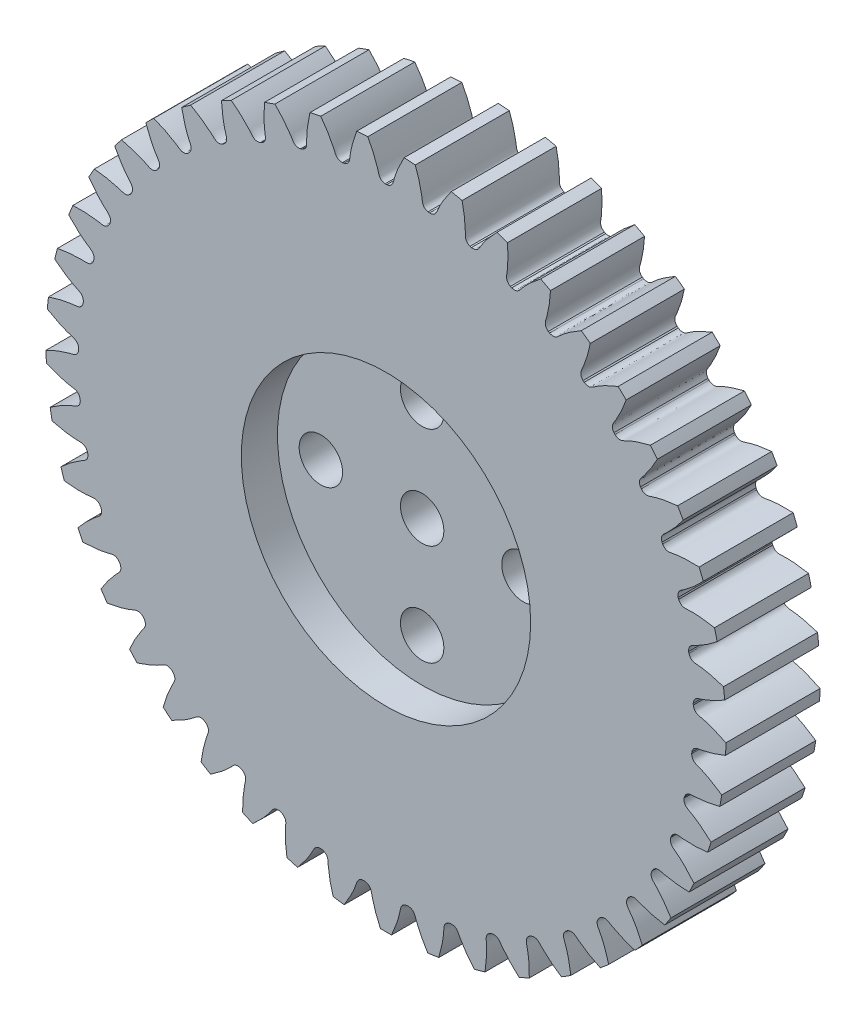
from build123d import *

# Parameters (mm, degrees)
SKETCH_1_R               = 23.5
EXTRUDE_1_DEPTH          = 6.5
CUT_EXTRUDE_1_DEPTH      = 34.863697376
PATTERN_CIRCULAR_1_COUNT = 45
SKETCH_4_R               = 1.5
CUT_EXTRUDE_2_DEPTH      = 10
SKETCH_5_R               = 1.5
CUT_EXTRUDE_3_DEPTH      = 10
SKETCH_6_R               = 10
CUT_EXTRUDE_4_DEPTH      = 2.5


with BuildPart() as part:
    # 草图1 → 凸台-拉伸1 (new body)
    with BuildSketch(Plane.XY):
        Circle(SKETCH_1_R)
    extrude(amount=EXTRUDE_1_DEPTH)

    # 草图2 → 切除-拉伸1 (cut, through all)
    with BuildSketch(Plane.XY):
        with BuildLine():
            ThreePointArc((0.051873264, 21.249936686), (0, 21.25), (-0.051873264, 21.249936686))
            add(Edge.make_bspline(
                [(-0.051873264, 21.249936686), (-0.443572136, 21.304099562), (-0.488057885, 21.594745963), (-0.580625684, 21.909595528), (-0.616187717, 22.023701477), (-0.656820366, 22.145031226), (-0.702678597, 22.273509106), (-0.754106978, 22.408946374), (-0.811388198, 22.551175843), (-0.874816981, 22.700012294), (-0.944678084, 22.855264244), (-1.021252408, 23.016730684), (-1.104814919, 23.184202197), (-1.195634949, 23.357460817), (-1.293975814, 23.536280256), (-1.400094629, 23.720426036), (-1.514242081, 23.909655655), (-1.636662209, 24.103718747), (-1.767592191, 24.302357255), (-1.907262137, 24.505305605), (-2.055894882, 24.712290888), (-2.213705786, 24.923033045), (-2.380902537, 25.137245056), (-2.557684962, 25.354633139), (-2.744244834, 25.574896952), (-2.940765714, 25.79772979), (-3.147422686, 26.022818809), (-3.44059804, 26.329597021), (-3.670417998, 26.555895846), (-3.828553255, 26.70565732)],
                knots=[0, 0, 0, 0, 0.112268392, 0.128789174, 0.146568276, 0.165605699, 0.185901442, 0.207455506, 0.23026789, 0.254338595, 0.27966762, 0.306254966, 0.334100632, 0.363204619, 0.393566926, 0.425187554, 0.458066503, 0.492203772, 0.527599361, 0.564253271, 0.602165502, 0.641336053, 0.681764924, 0.723452116, 0.766397629, 0.810601462, 0.856063616, 0.90278409, 1, 1, 1, 1], degree=3))
            ThreePointArc((-3.828553255, 26.70565732), (0, 26.978694426), (3.828553255, 26.70565732))
            add(Edge.make_bspline(
                [(0.051873264, 21.249936686), (0.443572136, 21.304099562), (0.488057885, 21.594745963), (0.580625684, 21.909595528), (0.616187717, 22.023701477), (0.656820366, 22.145031226), (0.702678597, 22.273509106), (0.754106978, 22.408946374), (0.811388198, 22.551175843), (0.874816981, 22.700012294), (0.944678084, 22.855264244), (1.021252408, 23.016730684), (1.104814919, 23.184202197), (1.195634949, 23.357460817), (1.293975814, 23.536280256), (1.400094629, 23.720426036), (1.514242081, 23.909655655), (1.636662209, 24.103718747), (1.767592191, 24.302357255), (1.907262137, 24.505305605), (2.055894882, 24.712290888), (2.213705786, 24.923033045), (2.380902537, 25.137245056), (2.557684962, 25.354633139), (2.744244834, 25.574896952), (2.940765714, 25.79772979), (3.147422686, 26.022818809), (3.44059804, 26.329597021), (3.670417998, 26.555895846), (3.828553255, 26.70565732)],
                knots=[0, 0, 0, 0, 0.112268392, 0.128789174, 0.146568276, 0.165605699, 0.185901442, 0.207455506, 0.23026789, 0.254338595, 0.27966762, 0.306254966, 0.334100632, 0.363204619, 0.393566926, 0.425187554, 0.458066503, 0.492203772, 0.527599361, 0.564253271, 0.602165502, 0.641336053, 0.681764924, 0.723452116, 0.766397629, 0.810601462, 0.856063616, 0.90278409, 1, 1, 1, 1], degree=3))
        make_face()
    cut_extrude_1 = extrude(amount=CUT_EXTRUDE_1_DEPTH, mode=Mode.SUBTRACT)

    # 阵列(圆周)1: 切除-拉伸1 ×45 about axis
    pattern_circular_1_axis = Axis((0, 0, 6.5), (0, 0, -1))
    for i in range(1, PATTERN_CIRCULAR_1_COUNT):
        add(cut_extrude_1.rotate(pattern_circular_1_axis, i * 360 / PATTERN_CIRCULAR_1_COUNT), mode=Mode.SUBTRACT)

    # 草图4 → 切除-拉伸2 (cut)
    with BuildSketch(Plane.XY.offset(6.5)):
        Circle(SKETCH_4_R)
    extrude(amount=-CUT_EXTRUDE_2_DEPTH, mode=Mode.SUBTRACT)

    # 草图5 → 切除-拉伸3 (cut)
    with BuildSketch(Plane.XY.offset(6.5)):
        with Locations((0, 7)):
            Circle(SKETCH_5_R)
        with Locations((7, 0)):
            Circle(SKETCH_5_R)
        with Locations((0, -7)):
            Circle(SKETCH_5_R)
        with Locations((-7, 0)):
            Circle(SKETCH_5_R)
    extrude(amount=-CUT_EXTRUDE_3_DEPTH, mode=Mode.SUBTRACT)

    # 草图6 → 切除-拉伸4 (cut)
    with BuildSketch(Plane.XY.offset(6.5)):
        Circle(SKETCH_6_R)
    extrude(amount=-CUT_EXTRUDE_4_DEPTH, mode=Mode.SUBTRACT)


solid = part.part
